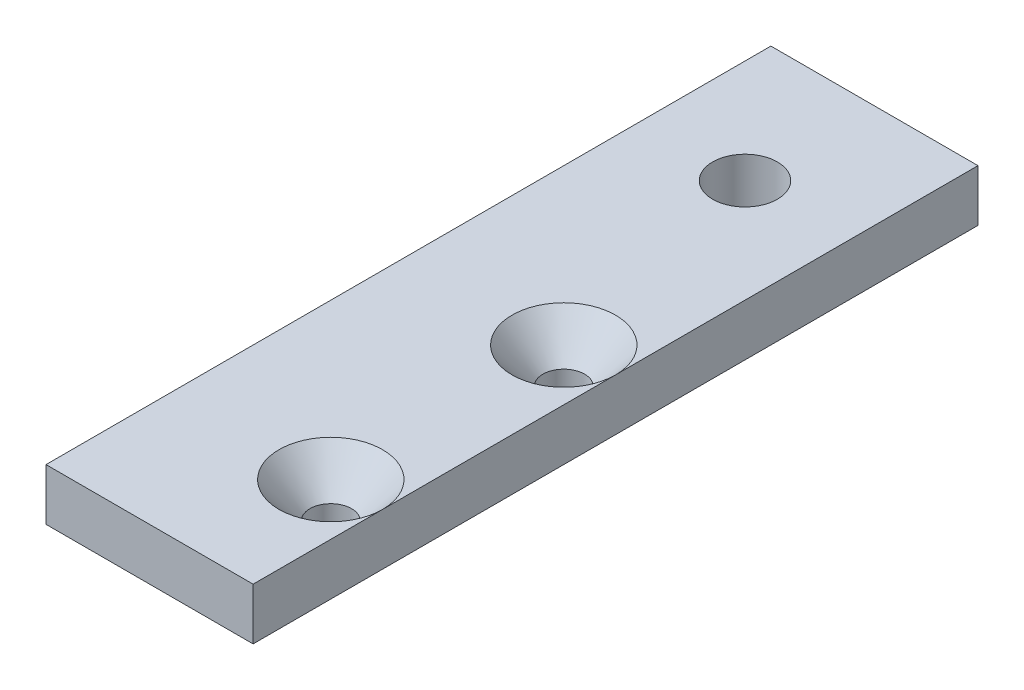
from build123d import *

# Parameters (mm, degrees)
SKETCH1_W                        = 25.4
SKETCH1_H                        = 88.9
BOSS_EXTRUDE1_DEPTH              = 6.35
F_1_4_20_TAPPED_HOLE1_AT_2_COUNT = 2
F_1_4_20_TAPPED_HOLE1_AT_2_PITCH = 28.575
F_3_8_16_TAPPED_HOLE1_D          = 7.9375


with BuildPart() as part:
    # Sketch1 → Boss-Extrude1 (new body)
    with BuildSketch(Plane(origin=(0, 0, 0), x_dir=(1, 0, 0), z_dir=(0, 1, 0))):
        with Locations((-12.7, 44.45)):
            Rectangle(SKETCH1_W, SKETCH1_H)
    extrude(amount=BOSS_EXTRUDE1_DEPTH)

    # Sketch3 → 1/4-20 Tapped Hole1 (revolve, cut)
    with BuildSketch(Plane(origin=(-6.35, 6.35, -15.875), x_dir=(0, 0, 1), z_dir=(1, 0, 0))):
        Polygon((0, 0), (0, 6.35), (2.5527, 6.35), (2.5527, 4.368293953), (6.35, 0), align=None)
    f_1_4_20_tapped_hole1 = revolve(axis=Axis((-6.35, 12.7, -15.875), (0, -1, 0)), mode=Mode.SUBTRACT)

    # 1/4-20 Tapped Hole1 at 2: 1/4-20 Tapped Hole1 ×2
    with Locations(*[(0, 0, -i * F_1_4_20_TAPPED_HOLE1_AT_2_PITCH) for i in range(1, F_1_4_20_TAPPED_HOLE1_AT_2_COUNT)]):
        add(f_1_4_20_tapped_hole1, mode=Mode.SUBTRACT)

    # 3/8-16 Tapped Hole1 (through all)
    with Locations(Plane(origin=(0, 6.35, 0), x_dir=(1, 0, 0), z_dir=(0, 1, 0))):
        with Locations((-12.7, 73.025)):
            Hole(F_3_8_16_TAPPED_HOLE1_D / 2)


solid = part.part
